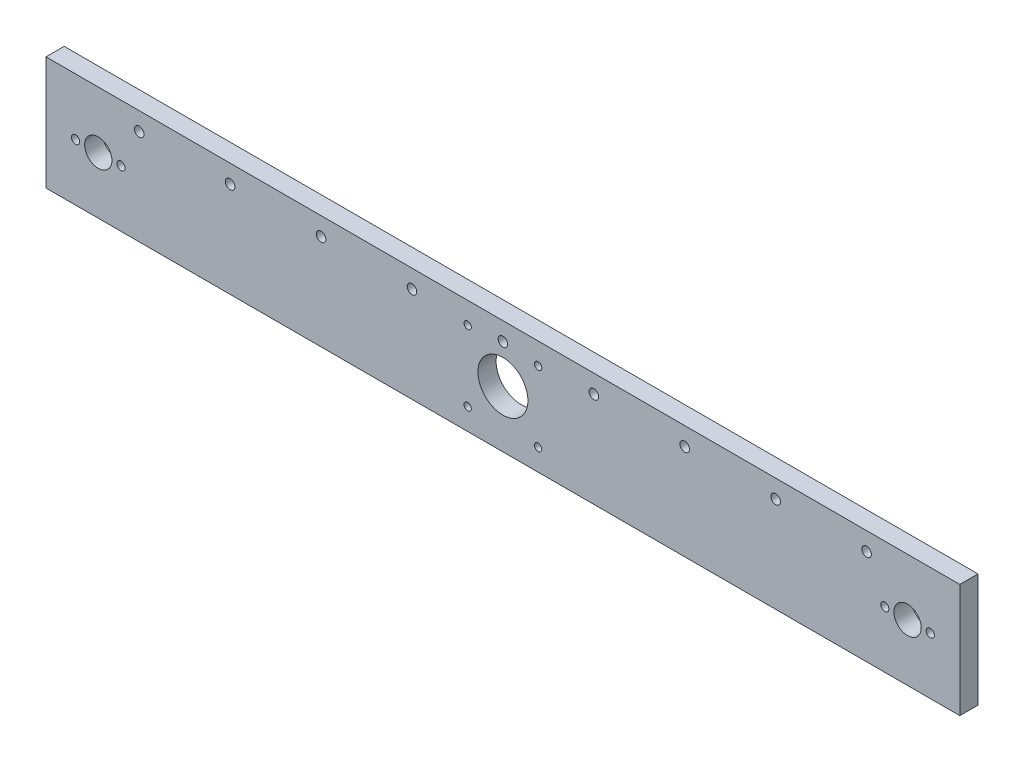
from build123d import *

# Parameters (mm, degrees)
SKETCH1_W           = 402
SKETCH1_H           = 50
SKETCH1_R           = 6
SKETCH1_R_2         = 1.8
SKETCH1_R_3         = 11
SKETCH1_R_4         = 1.6
SKETCH1_R_5         = 2.1
BOSS_EXTRUDE1_DEPTH = 8


with BuildPart() as part:
    # Sketch1 → Boss-Extrude1 (new body)
    with BuildSketch(Plane.XY):
        Rectangle(SKETCH1_W, SKETCH1_H)
        with Locations((-178, 0)):
            Circle(SKETCH1_R, mode=Mode.SUBTRACT)
        with Locations((168, 0)):
            Circle(SKETCH1_R_2, mode=Mode.SUBTRACT)
        Circle(SKETCH1_R_3, mode=Mode.SUBTRACT)
        with Locations((-188, 0)):
            Circle(SKETCH1_R_2, mode=Mode.SUBTRACT)
        with Locations((-168, 0)):
            Circle(SKETCH1_R_2, mode=Mode.SUBTRACT)
        with Locations((188, 0)):
            Circle(SKETCH1_R_2, mode=Mode.SUBTRACT)
        with Locations((178, 0)):
            Circle(SKETCH1_R, mode=Mode.SUBTRACT)
        with Locations((-15.5, 15.5)):
            Circle(SKETCH1_R_4, mode=Mode.SUBTRACT)
        with Locations((15.5, 15.5)):
            Circle(SKETCH1_R_4, mode=Mode.SUBTRACT)
        with Locations((-15.5, -15.5)):
            Circle(SKETCH1_R_4, mode=Mode.SUBTRACT)
        with Locations((15.5, -15.5)):
            Circle(SKETCH1_R_4, mode=Mode.SUBTRACT)
        with Locations((0, 17)):
            Circle(SKETCH1_R_5, mode=Mode.SUBTRACT)
        with Locations((40, 17)):
            Circle(SKETCH1_R_5, mode=Mode.SUBTRACT)
        with Locations((80, 17)):
            Circle(SKETCH1_R_5, mode=Mode.SUBTRACT)
        with Locations((120, 17)):
            Circle(SKETCH1_R_5, mode=Mode.SUBTRACT)
        with Locations((160, 17)):
            Circle(SKETCH1_R_5, mode=Mode.SUBTRACT)
        with Locations((-40, 17)):
            Circle(SKETCH1_R_5, mode=Mode.SUBTRACT)
        with Locations((-80, 17)):
            Circle(SKETCH1_R_5, mode=Mode.SUBTRACT)
        with Locations((-120, 17)):
            Circle(SKETCH1_R_5, mode=Mode.SUBTRACT)
        with Locations((-160, 17)):
            Circle(SKETCH1_R_5, mode=Mode.SUBTRACT)
    extrude(amount=BOSS_EXTRUDE1_DEPTH)


solid = part.part
